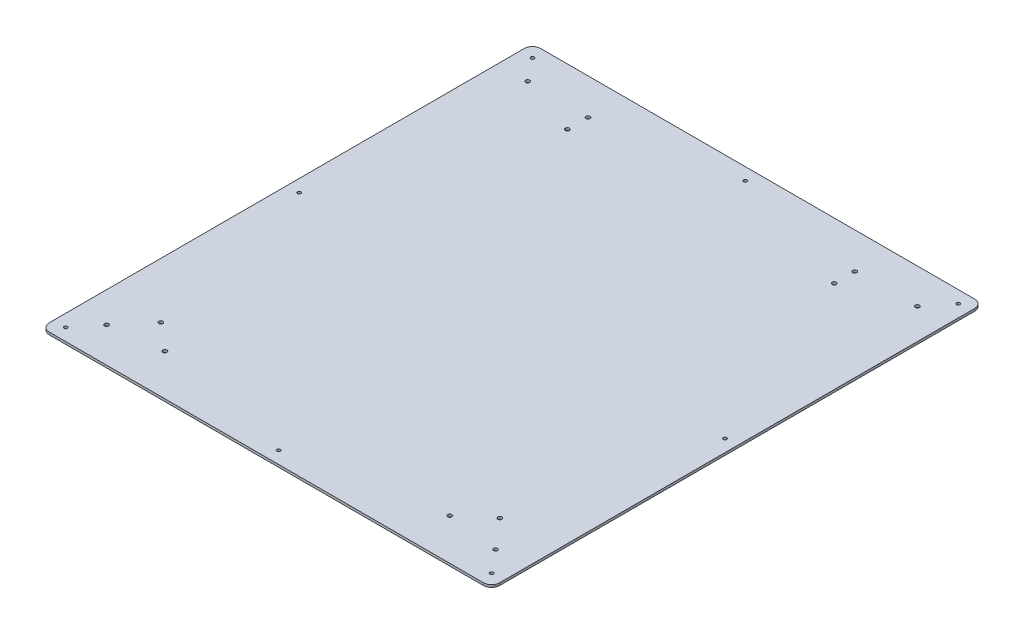
from build123d import *

# Parameters (mm, degrees)
SKETCH_1_R             = 2.1
SKETCH_1_R_2           = 2.5
SM_BASE_FLANGE_1_DEPTH = 3


# Sheet-metal steps are written as plain solids
with BuildPart() as part:
    # Sketch 1 → 基体-法兰1 (new body)
    with BuildSketch(Plane(origin=(0, 0, 0), x_dir=(1, 0, 0), z_dir=(0, 1, 0))):
        with BuildLine():
            Line((-265, -300), (265, -300))
            ThreePointArc((265, -300), (272.071067812, -297.071067812), (275, -290))
            Line((275, -290), (275, 290))
            ThreePointArc((275, 290), (272.071067812, 297.071067812), (265, 300))
            Line((265, 300), (-265, 300))
            ThreePointArc((-265, 300), (-272.071067812, 297.071067812), (-275, 290))
            Line((-275, 290), (-275, -290))
            ThreePointArc((-275, -290), (-272.071067812, -297.071067812), (-265, -300))
        make_face()
        with Locations(Location((-260, 285, 0), (0, 0, 270))):
            Circle(SKETCH_1_R, mode=Mode.SUBTRACT)
        with Locations(Location((260, 285, 0), (0, 0, 90))):
            Circle(SKETCH_1_R, mode=Mode.SUBTRACT)
        with Locations(Location((260, -285, 0), (0, 0, 270))):
            Circle(SKETCH_1_R, mode=Mode.SUBTRACT)
        with Locations(Location((-260, -285, 0), (0, 0, 90))):
            Circle(SKETCH_1_R, mode=Mode.SUBTRACT)
        with Locations(Location((-260, 0, 0), (0, 0, 270))):
            Circle(SKETCH_1_R, mode=Mode.SUBTRACT)
        with Locations(Location((0, 285, 0), (0, 0, 270))):
            Circle(SKETCH_1_R, mode=Mode.SUBTRACT)
        with Locations(Location((260, 0, 0), (0, 0, 270))):
            Circle(SKETCH_1_R, mode=Mode.SUBTRACT)
        with Locations(Location((0, -285, 0), (0, 0, 270))):
            Circle(SKETCH_1_R, mode=Mode.SUBTRACT)
        with Locations(Location((206.776192938, -221.647543625, 0), (0, 0, 270))):
            Circle(SKETCH_1_R_2, mode=Mode.SUBTRACT)
        with Locations(Location((173.776192938, -249.647543625, 0), (0, 0, 270))):
            Circle(SKETCH_1_R_2, mode=Mode.SUBTRACT)
        with Locations(Location((-174.223807062, -249.647543625, 0), (0, 0, 270))):
            Circle(SKETCH_1_R_2, mode=Mode.SUBTRACT)
        with Locations(Location((-207.223807062, -221.647543625, 0), (0, 0, 270))):
            Circle(SKETCH_1_R_2, mode=Mode.SUBTRACT)
        with Locations(Location((-237.776192938, -257.352456375, 0), (0, 0, 270))):
            Circle(SKETCH_1_R_2, mode=Mode.SUBTRACT)
        with Locations(Location((237.328578815, -257.352456375, 0), (0, 0, 270))):
            Circle(SKETCH_1_R_2, mode=Mode.SUBTRACT)
        with Locations(Location((237.776192938, 257.352456375, 0), (0, 0, 270))):
            Circle(SKETCH_1_R_2, mode=Mode.SUBTRACT)
        with Locations(Location((162.687716862, 230.852456375, 0), (0, 0, 270))):
            Circle(SKETCH_1_R_2, mode=Mode.SUBTRACT)
        with Locations(Location((162.687716862, 255.852456375, 0), (0, 0, 270))):
            Circle(SKETCH_1_R_2, mode=Mode.SUBTRACT)
        with Locations(Location((-163.135330986, 255.852456375, 0), (0, 0, 270))):
            Circle(SKETCH_1_R_2, mode=Mode.SUBTRACT)
        with Locations(Location((-238.223807062, 257.352456375, 0), (0, 0, 270))):
            Circle(SKETCH_1_R_2, mode=Mode.SUBTRACT)
        with Locations(Location((-163.135330986, 230.852456375, 0), (0, 0, 270))):
            Circle(SKETCH_1_R_2, mode=Mode.SUBTRACT)
    extrude(amount=-SM_BASE_FLANGE_1_DEPTH)


solid = part.part
